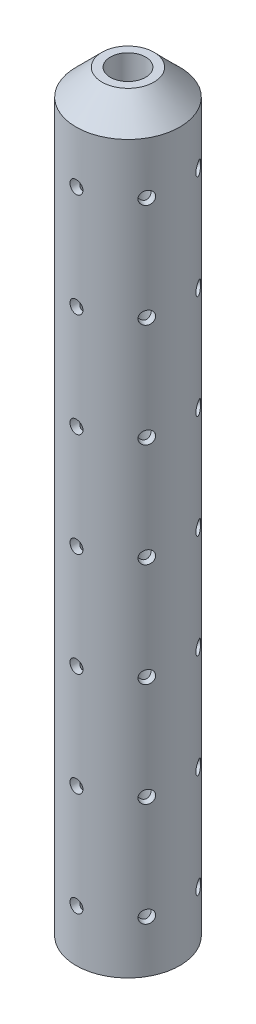
from build123d import *

# Parameters (mm, degrees)
SKETCH1_R               = 6.35
BOSS_EXTRUDE1_DEPTH     = 88.9
SKETCH2_R               = 6.35
SKETCH2_R_2             = 2.159
BOSS_EXTRUDE2_DEPTH     = 3.175
CHAMFER1_SIZE           = 3.175
SKETCH4_R               = 0.79375
CUT_EXTRUDE1_DEPTH      = 88.9
CUT_EXTRUDE2_REACH      = 96.239
CUT_EXTRUDE2_END_RADIUS = 0.79375
SKETCH3_R               = 0.79375
CIRPATTERN1_COUNT       = 6


with BuildPart() as part:
    # Sketch1 → Boss-Extrude1 (new body)
    with BuildSketch(Plane(origin=(0, 0, 0), x_dir=(1, 0, 0), z_dir=(0, 1, 0))):
        Circle(SKETCH1_R)
        Polygon((3.695503603, 0), (1.847751802, 3.2004), (-1.847751802, 3.2004), (-3.695503603, 0), (-1.847751802, -3.2004), (1.847751802, -3.2004), align=None, mode=Mode.SUBTRACT)
    extrude(amount=BOSS_EXTRUDE1_DEPTH)

    # Sketch2 → Boss-Extrude2 (add)
    with BuildSketch(Plane(origin=(0, 88.9, 0), x_dir=(1, 0, 0), z_dir=(0, 1, 0))):
        Circle(SKETCH2_R)
        Circle(SKETCH2_R_2, mode=Mode.SUBTRACT)
    extrude(amount=BOSS_EXTRUDE2_DEPTH)

    # Chamfer1
    chamfer1_edges = [part.edges().sort_by_distance(p)[0] for p in [
        (-6.35, 92.075, 0),
    ]]
    chamfer(chamfer1_edges, length=CHAMFER1_SIZE)

    # Sketch4 → Cut-Extrude1 (cut)
    with BuildSketch(Plane.XZ):
        with Locations((0, 4.7625)):
            Circle(SKETCH4_R)
    cut_extrude1 = extrude(amount=-CUT_EXTRUDE1_DEPTH, mode=Mode.SUBTRACT)

    # Cut-Extrude2: up to this cylinder (the profile starts outside it)
    cut_extrude2_end = Plane(origin=(0, 44.45, 4.7625), z_dir=(0, -1, 0)) * Cylinder(CUT_EXTRUDE2_END_RADIUS, 271.2655, mode=Mode.PRIVATE)
    # Sketch3 → Cut-Extrude2 (cut, up to the surface)
    with BuildSketch(Plane.XY.offset(12.7), mode=Mode.PRIVATE) as cut_extrude2_sk1:
        with Locations((0, 82.55)):
            Circle(SKETCH3_R)
    cut_extrude2_tool1 = extrude(cut_extrude2_sk1.sketch, amount=-CUT_EXTRUDE2_REACH, mode=Mode.PRIVATE) - cut_extrude2_end
    # Sketch3 → Cut-Extrude2 (cut, up to the surface)
    with BuildSketch(Plane.XY.offset(12.7), mode=Mode.PRIVATE) as cut_extrude2_sk2:
        with Locations((0, 69.85)):
            Circle(SKETCH3_R)
    cut_extrude2_tool2 = extrude(cut_extrude2_sk2.sketch, amount=-CUT_EXTRUDE2_REACH, mode=Mode.PRIVATE) - cut_extrude2_end
    # Sketch3 → Cut-Extrude2 (cut, up to the surface)
    with BuildSketch(Plane.XY.offset(12.7), mode=Mode.PRIVATE) as cut_extrude2_sk3:
        with Locations((0, 57.15)):
            Circle(SKETCH3_R)
    cut_extrude2_tool3 = extrude(cut_extrude2_sk3.sketch, amount=-CUT_EXTRUDE2_REACH, mode=Mode.PRIVATE) - cut_extrude2_end
    # Sketch3 → Cut-Extrude2 (cut, up to the surface)
    with BuildSketch(Plane.XY.offset(12.7), mode=Mode.PRIVATE) as cut_extrude2_sk4:
        with Locations((0, 44.45)):
            Circle(SKETCH3_R)
    cut_extrude2_tool4 = extrude(cut_extrude2_sk4.sketch, amount=-CUT_EXTRUDE2_REACH, mode=Mode.PRIVATE) - cut_extrude2_end
    # Sketch3 → Cut-Extrude2 (cut, up to the surface)
    with BuildSketch(Plane.XY.offset(12.7), mode=Mode.PRIVATE) as cut_extrude2_sk5:
        with Locations((0, 31.75)):
            Circle(SKETCH3_R)
    cut_extrude2_tool5 = extrude(cut_extrude2_sk5.sketch, amount=-CUT_EXTRUDE2_REACH, mode=Mode.PRIVATE) - cut_extrude2_end
    # Sketch3 → Cut-Extrude2 (cut, up to the surface)
    with BuildSketch(Plane.XY.offset(12.7), mode=Mode.PRIVATE) as cut_extrude2_sk6:
        with Locations((0, 19.05)):
            Circle(SKETCH3_R)
    cut_extrude2_tool6 = extrude(cut_extrude2_sk6.sketch, amount=-CUT_EXTRUDE2_REACH, mode=Mode.PRIVATE) - cut_extrude2_end
    # Sketch3 → Cut-Extrude2 (cut, up to the surface)
    with BuildSketch(Plane.XY.offset(12.7), mode=Mode.PRIVATE) as cut_extrude2_sk7:
        with Locations((0, 6.35)):
            Circle(SKETCH3_R)
    cut_extrude2_tool7 = extrude(cut_extrude2_sk7.sketch, amount=-CUT_EXTRUDE2_REACH, mode=Mode.PRIVATE) - cut_extrude2_end
    cut_extrude2 = cut_extrude2_tool1.solids().sort_by_distance((0, 82.55, 12.7))[0] + cut_extrude2_tool2.solids().sort_by_distance((0, 69.85, 12.7))[0] + cut_extrude2_tool3.solids().sort_by_distance((0, 57.15, 12.7))[0] + cut_extrude2_tool4.solids().sort_by_distance((0, 44.45, 12.7))[0] + cut_extrude2_tool5.solids().sort_by_distance((0, 31.75, 12.7))[0] + cut_extrude2_tool6.solids().sort_by_distance((0, 19.05, 12.7))[0] + cut_extrude2_tool7.solids().sort_by_distance((0, 6.35, 12.7))[0]
    add(cut_extrude2, mode=Mode.SUBTRACT)

    # CirPattern1: Cut-Extrude1, Cut-Extrude2 ×6 about axis
    cirpattern1_axis = Axis((0, 92.075, 0), (0, 1, 0))
    add([cut_extrude1.rotate(cirpattern1_axis, i * 360 / CIRPATTERN1_COUNT) for i in range(1, CIRPATTERN1_COUNT)], mode=Mode.SUBTRACT)
    add([cut_extrude2.rotate(cirpattern1_axis, i * 360 / CIRPATTERN1_COUNT) for i in range(1, CIRPATTERN1_COUNT)], mode=Mode.SUBTRACT)


solid = part.part
